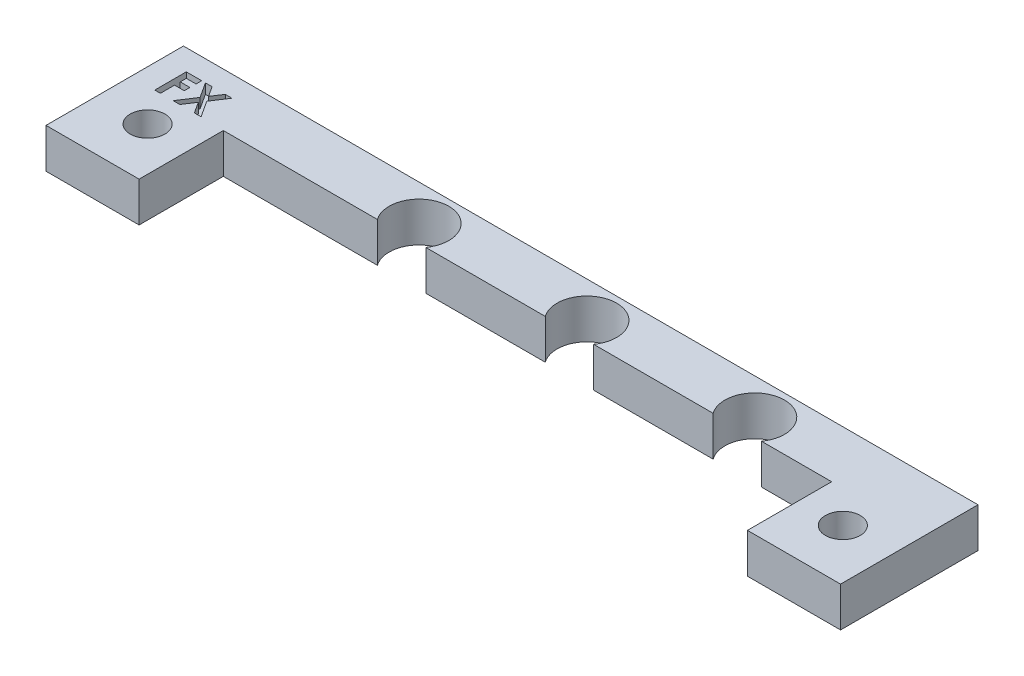
from build123d import *

# Parameters (mm, degrees)
BOSS_EXTRUDE1_OUTLINE_R = 1.75
BOSS_EXTRUDE1_DEPTH     = 4
CUT_EXTRUDE1_DEPTH      = 1


# Read off the part's stored shape, not the designer's step: Boss-Extrude1
with BuildPart() as part:
    # Boss-Extrude1 outline → Boss-Extrude1 (new body)
    with BuildSketch(Plane(origin=(0, 0, 0), x_dir=(1, 0, 0), z_dir=(0, 1, 0))):
        with BuildLine():
            Line((25.516474615, -10.33744254), (37.54307775, -10.33744254))
            ThreePointArc((37.54307775, -10.33744254), (39.979776182, -5.587442326), (42.416474615, -10.33744254))
            Line((42.416474615, -10.33744254), (49.479776182, -10.33744254))
            Line((49.479776182, -10.33744254), (49.479776182, -18.81631662))
            Line((49.479776182, -18.81631662), (58.854776182, -18.81631662))
            Line((58.854776182, -18.81631662), (58.854776182, -4.977921711))
            Line((58.854776182, -4.977921711), (-21.145223818, -4.977921711))
            Line((-21.145223818, -4.977921711), (-21.145223818, -18.81631662))
            Line((-21.145223818, -18.81631662), (-11.770223818, -18.81631662))
            Line((-11.770223818, -18.81631662), (-11.770223818, -10.33744254))
            Line((-11.770223818, -10.33744254), (3.74307775, -10.33744254))
            ThreePointArc((3.74307775, -10.33744254), (6.179776182, -5.587442326), (8.616474615, -10.33744254))
            Line((8.616474615, -10.33744254), (20.64307775, -10.33744254))
            ThreePointArc((20.64307775, -10.33744254), (23.079776182, -5.587442326), (25.516474615, -10.33744254))
        make_face()
        with Locations((-16.145223818, -13.587442433)):
            Circle(BOSS_EXTRUDE1_OUTLINE_R, mode=Mode.SUBTRACT)
        with Locations((53.854776182, -13.587442433)):
            Circle(BOSS_EXTRUDE1_OUTLINE_R, mode=Mode.SUBTRACT)
    extrude(amount=BOSS_EXTRUDE1_DEPTH)

    # Sketch2 → Cut-Extrude1 (cut)
    with BuildSketch(Plane(origin=(0, 4, 0), x_dir=(1, 0, 0), z_dir=(0, 1, 0))):
        Polygon((-18.749121586, -7.085274104), (-17.202326714, -7.085274104), (-17.202326714, -7.655145899), (-18.179249791, -7.655145899), (-18.179249791, -8.265722822), (-17.202326714, -8.265722822), (-17.202326714, -8.835594617), (-18.179249791, -8.835594617), (-18.179249791, -10.260274104), (-18.749121586, -10.260274104), align=None)
        Polygon((-16.826440296, -7.085274104), (-16.15480568, -7.085274104), (-15.491439294, -8.104810362), (-14.826800873, -7.085274104), (-14.153258204, -7.085274104), (-15.154985969, -8.621256676), (-14.088384406, -10.260274104), (-14.760019022, -10.260274104), (-15.491439294, -9.136430955), (-16.224131602, -10.260274104), (-16.897038253, -10.260274104), (-15.827256602, -8.619984641), align=None)
    extrude(amount=-CUT_EXTRUDE1_DEPTH, mode=Mode.SUBTRACT)


solid = part.part
